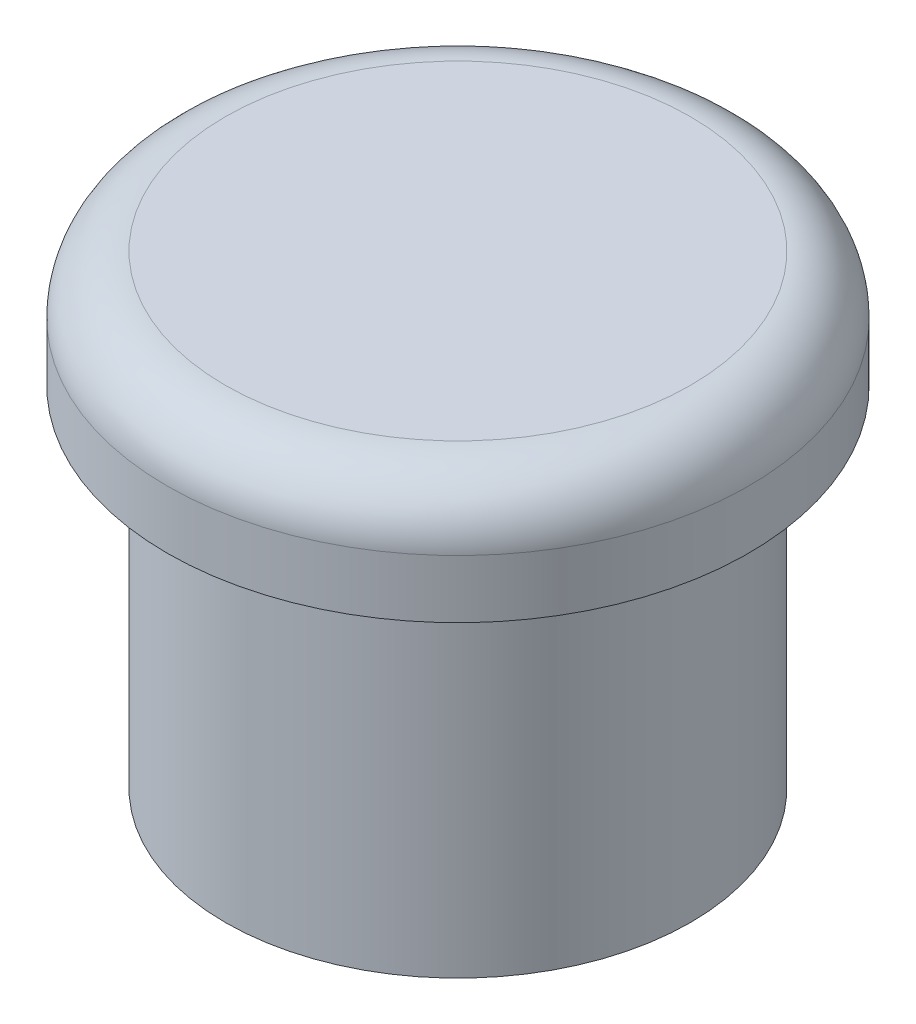
from build123d import *

# Parameters (mm, degrees)
SKETCH1_R           = 2
SKETCH1_R_2         = 1.5875
BOSS_EXTRUDE1_DEPTH = 3
SKETCH2_R           = 2.5
BOSS_EXTRUDE2_DEPTH = 1
FILLET1_R           = 0.5


with BuildPart() as part:
    # Sketch1 → Boss-Extrude1 (new body)
    with BuildSketch(Plane(origin=(0, 0, 0), x_dir=(1, 0, 0), z_dir=(0, 1, 0))):
        Circle(SKETCH1_R)
        Circle(SKETCH1_R_2, mode=Mode.SUBTRACT)
    extrude(amount=BOSS_EXTRUDE1_DEPTH)

    # Sketch2 → Boss-Extrude2 (add)
    with BuildSketch(Plane(origin=(0, 3, 0), x_dir=(1, 0, 0), z_dir=(0, 1, 0))):
        Circle(SKETCH2_R)
    extrude(amount=BOSS_EXTRUDE2_DEPTH)

    # Fillet1
    fillet1_edges = [part.edges().sort_by_distance(p)[0] for p in [
        (-2.5, 4, 0),
    ]]
    fillet(fillet1_edges, radius=FILLET1_R)


solid = part.part
